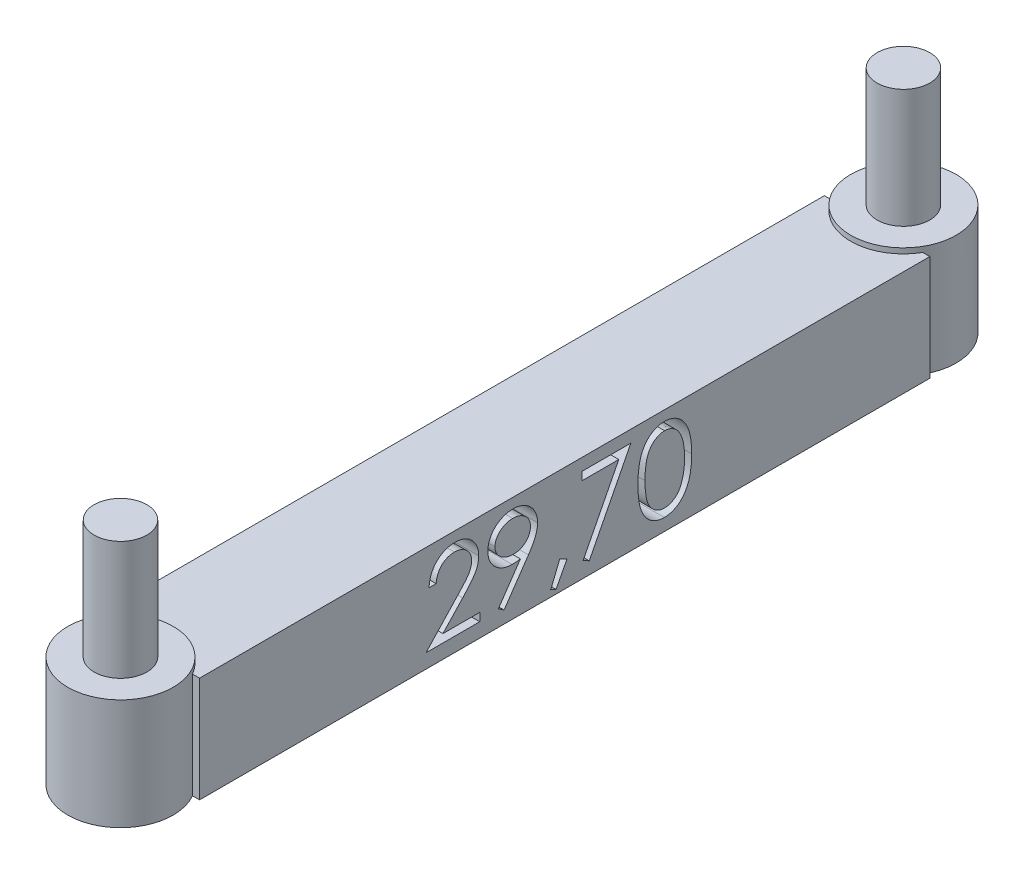
from build123d import *

# Parameters (mm, degrees)
SKIZZE1_W                            = 4
SKIZZE1_H                            = 4
AUFSATZ_LINEAR_AUSTRAGEN1_DEPTH      = 27.7
AUFSATZ_LINEAR_AUSTRAGEN2_DEPTH      = 0.2
AUFSATZ_LINEAR_AUSTRAGEN2_DEPTH_BACK = 4
AUFSATZ_LINEAR_AUSTRAGEN2_START      = 2
SKIZZE2_R                            = 2
SKIZZE3_R                            = 1
AUFSATZ_LINEAR_AUSTRAGEN4_DEPTH      = 4.5
SCHNITT_LINEAR_AUSTRAGEN2_DEPTH      = 1


with BuildPart() as part:
    # Skizze1 → Aufsatz-Linear austragen1 (new body)
    with BuildSketch(Plane.XY):
        Rectangle(SKIZZE1_W, SKIZZE1_H)
    extrude(amount=AUFSATZ_LINEAR_AUSTRAGEN1_DEPTH)

    # Skizze2 → Aufsatz-Linear austragen2 (add, two sides: drawn at the far end of the back side and taken through both)
    with BuildSketch(Plane(origin=(0, 0, 0), x_dir=(1, 0, 0), z_dir=(0, 1, 0)).offset(AUFSATZ_LINEAR_AUSTRAGEN2_START - AUFSATZ_LINEAR_AUSTRAGEN2_DEPTH_BACK)):
        with Locations((0, -28.7)):
            Circle(SKIZZE2_R)
        with Locations((0, 1)):
            Circle(SKIZZE2_R)
    extrude(amount=AUFSATZ_LINEAR_AUSTRAGEN2_DEPTH + AUFSATZ_LINEAR_AUSTRAGEN2_DEPTH_BACK)

    # Skizze3 → Aufsatz-Linear austragen4 (add)
    with BuildSketch(Plane(origin=(0, 2.2, 0), x_dir=(1, 0, 0), z_dir=(0, 1, 0))):
        with Locations((0, -28.7)):
            Circle(SKIZZE3_R)
        with Locations((0, 1)):
            Circle(SKIZZE3_R)
    extrude(amount=AUFSATZ_LINEAR_AUSTRAGEN4_DEPTH)

    # Skizze4 → Schnitt-Linear austragen2 (cut)
    # profile 1 of 5: a face of its own
    with BuildSketch(Plane(origin=(2, 0, 0), x_dir=(0, 0, -1), z_dir=(1, 0, 0))):
        with BuildLine():
            Line((-18.72561599, 0.616837358), (-18.994846759, 0.616837358))
            add(Edge.make_bspline(
                [(-18.994846759, 0.616837358), (-18.993092057, 0.652555261), (-18.989645867, 0.722704274), (-18.973507334, 0.824981908), (-18.950415153, 0.922743164), (-18.917765336, 1.01520309), (-18.877217098, 1.103179211), (-18.82859136, 1.186322081), (-18.770996631, 1.264314529), (-18.705676573, 1.336433537), (-18.634732025, 1.402594312), (-18.558184077, 1.459727378), (-18.477745482, 1.507999667), (-18.393660283, 1.548355018), (-18.3049798, 1.578646314), (-18.212508779, 1.601122005), (-18.115840948, 1.614644587), (-18.049978072, 1.616098118), (-18.016481375, 1.616837358)],
                knots=[0, 0, 0, 0, 1.10065271, 2.161652631, 3.183658789, 4.190468796, 5.17591951, 6.163126047, 7.15150782, 8.156236427, 9.156009102, 10.134482811, 11.092018607, 12.041330605, 13.001268258, 13.972401359, 14.968799086, 16, 16, 16, 16], degree=3))
            add(Edge.make_bspline(
                [(-18.016481375, 1.616837358), (-17.983585883, 1.616067252), (-17.918947416, 1.614554022), (-17.824608546, 1.601558854), (-17.734799437, 1.58120549), (-17.649695637, 1.552649419), (-17.569976153, 1.514262767), (-17.495042115, 1.468150591), (-17.42400142, 1.414819307), (-17.360052748, 1.352030324), (-17.301331537, 1.284999709), (-17.250672461, 1.213438648), (-17.20728975, 1.139527832), (-17.171128881, 1.062703659), (-17.144509334, 0.982242778), (-17.124299441, 0.899316604), (-17.112875944, 0.813066766), (-17.111122724, 0.754689718), (-17.110231375, 0.725010435)],
                knots=[0, 0, 0, 0, 1.111607364, 2.184268762, 3.212621178, 4.221274766, 5.211760367, 6.196651075, 7.1921475, 8.207485113, 9.220403448, 10.201281604, 11.166441695, 12.114753415, 13.065576456, 14.026450734, 14.996634279, 16, 16, 16, 16], degree=3))
            add(Edge.make_bspline(
                [(-17.110231375, 0.725010435), (-17.111682743, 0.683226576), (-17.11456001, 0.600392108), (-17.139172332, 0.478665082), (-17.177612199, 0.360727866), (-17.223895648, 0.265810178), (-17.270586314, 0.189324327), (-17.312661321, 0.126351151), (-17.361916873, 0.058546464), (-17.419069871, -0.013862682), (-17.482938047, -0.091443458), (-17.554099902, -0.174148997), (-17.633062886, -0.2611248), (-17.688484458, -0.320529601), (-17.717202528, -0.351311681)],
                knots=[0, 0, 0, 0, 1.184426356, 2.348067706, 3.509069118, 4.696110526, 5.333549288, 6.050745305, 6.844228056, 7.710549037, 8.667450064, 9.695053472, 10.805634456, 12, 12, 12, 12], degree=3))
            Line((-17.717202528, -0.351311681), (-18.46780349, -1.152393412))
            Line((-18.46780349, -1.152393412), (-17.071769836, -1.152393412))
            Line((-17.071769836, -1.152393412), (-17.071769836, -1.460085719))
            Line((-17.071769836, -1.460085719), (-19.110231375, -1.460085719))
            Line((-19.110231375, -1.460085719), (-17.946769836, -0.218499181))
            add(Edge.make_bspline(
                [(-17.946769836, -0.218499181), (-17.918443076, -0.188929204), (-17.864033167, -0.132131329), (-17.787076673, -0.049208792), (-17.71795754, 0.027719386), (-17.656228346, 0.098507856), (-17.603228199, 0.164192057), (-17.556194857, 0.22264466), (-17.518510065, 0.276434189), (-17.477611154, 0.338783286), (-17.43799917, 0.414908129), (-17.403960008, 0.507937006), (-17.383204423, 0.603703223), (-17.380714564, 0.668419254), (-17.379462144, 0.700971973)],
                knots=[0, 0, 0, 0, 1.329631726, 2.553950428, 3.673215718, 4.687767853, 5.603093632, 6.413772471, 7.123043292, 7.734684054, 8.834405432, 9.900288307, 10.943827018, 12, 12, 12, 12], degree=3))
            add(Edge.make_bspline(
                [(-17.379462144, 0.700971973), (-17.380007066, 0.721441743), (-17.381081002, 0.761783729), (-17.390559029, 0.820931523), (-17.40488232, 0.877987077), (-17.425406827, 0.933125894), (-17.452498318, 0.985793595), (-17.485475501, 1.036054293), (-17.523524127, 1.084644834), (-17.5675395, 1.130204804), (-17.615892232, 1.171931552), (-17.666973017, 1.208895053), (-17.721015964, 1.23978572), (-17.777793211, 1.265108717), (-17.837146471, 1.28497333), (-17.899190538, 1.298737827), (-17.96375398, 1.307379956), (-18.007839834, 1.308549246), (-18.03030349, 1.30914505)],
                knots=[0, 0, 0, 0, 0.991446411, 1.95395049, 2.89581595, 3.838931463, 4.798493298, 5.75982156, 6.748411868, 7.785213223, 8.824556874, 9.840280684, 10.836137867, 11.835679398, 12.848801643, 13.863922112, 14.911575587, 16, 16, 16, 16], degree=3))
            add(Edge.make_bspline(
                [(-18.03030349, 1.30914505), (-18.053764204, 1.308532165), (-18.099837172, 1.307328561), (-18.167482057, 1.298909134), (-18.232012724, 1.284384128), (-18.293591498, 1.264518407), (-18.352322571, 1.239268223), (-18.407920323, 1.207818156), (-18.460259943, 1.170289447), (-18.50943982, 1.127740399), (-18.554751802, 1.08036817), (-18.59456341, 1.02755963), (-18.629349708, 0.970278988), (-18.659700479, 0.908680802), (-18.684348214, 0.842206133), (-18.703182342, 0.771090958), (-18.718085354, 0.695644059), (-18.723064086, 0.643542558), (-18.72561599, 0.616837358)],
                knots=[0, 0, 0, 0, 1.031018746, 2.02475058, 2.990194455, 3.934040569, 4.864654155, 5.795059489, 6.735614925, 7.690564532, 8.649604399, 9.611025574, 10.590972636, 11.591080095, 12.624614302, 13.701020113, 14.821632451, 16, 16, 16, 16], degree=3))
        make_face()
    # profile 2 of 5: a face of its own
    with BuildSketch(Plane(origin=(2, 0, 0), x_dir=(0, 0, -1), z_dir=(1, 0, 0))):
        with BuildLine():
            Line((-16.148692913, -1.537008796), (-16.363837144, -1.387369373))
            Line((-16.363837144, -1.387369373), (-15.529702528, -0.168018412))
            add(Edge.make_bspline(
                [(-15.529702528, -0.168018412), (-15.582923159, -0.174526752), (-15.687717548, -0.187342036), (-15.793263635, -0.189696311), (-15.845207336, -0.19085495)],
                knots=[0, 0, 0, 0, 1.015715272, 2, 2, 2, 2], degree=3))
            add(Edge.make_bspline(
                [(-15.845207336, -0.19085495), (-15.87670052, -0.190048313), (-15.938518886, -0.188464955), (-16.029403159, -0.175914834), (-16.11673364, -0.156586153), (-16.200278802, -0.127744363), (-16.280352663, -0.091900184), (-16.356780418, -0.047451315), (-16.429459181, 0.004839792), (-16.49760839, 0.064696642), (-16.55958988, 0.130420687), (-16.61480985, 0.199982667), (-16.660702248, 0.274190642), (-16.698825036, 0.35153083), (-16.727736853, 0.433114845), (-16.748790457, 0.518014331), (-16.761752475, 0.60682431), (-16.763294557, 0.667274422), (-16.764077528, 0.697967165)],
                knots=[0, 0, 0, 0, 1.060718605, 2.082097864, 3.085795603, 4.069760067, 5.054557537, 6.03741023, 7.043284206, 8.066802108, 9.088538119, 10.083643548, 11.053783639, 12.022749082, 12.983451788, 13.964007469, 14.966251758, 16, 16, 16, 16], degree=3))
            add(Edge.make_bspline(
                [(-16.764077528, 0.697967165), (-16.76259087, 0.739940296), (-16.759672861, 0.822325038), (-16.736188418, 0.94269684), (-16.69756527, 1.056513877), (-16.643712376, 1.1634769), (-16.575882614, 1.262047248), (-16.494360966, 1.350854628), (-16.399643282, 1.428635931), (-16.293887266, 1.495496569), (-16.179584676, 1.549269423), (-16.059868684, 1.58890311), (-15.935656581, 1.612216322), (-15.851512864, 1.615289917), (-15.809149644, 1.616837358)],
                knots=[0, 0, 0, 0, 1.022988612, 2.007919123, 2.978103895, 3.94594894, 4.918897164, 5.887013414, 6.875921846, 7.89917871, 8.930658928, 9.948724884, 10.967259574, 12, 12, 12, 12], degree=3))
            add(Edge.make_bspline(
                [(-15.809149644, 1.616837358), (-15.767588141, 1.615268647), (-15.68546653, 1.612169021), (-15.564704524, 1.589468476), (-15.449040795, 1.551208471), (-15.339116521, 1.498335988), (-15.237339882, 1.432060924), (-15.145817758, 1.353088475), (-15.066638725, 1.261369452), (-14.999932541, 1.159122174), (-14.946386792, 1.049264762), (-14.907753407, 0.934592828), (-14.883971431, 0.815931067), (-14.880974579, 0.735535804), (-14.879462144, 0.694962358)],
                knots=[0, 0, 0, 0, 1.026385292, 2.028040595, 3.023318987, 4.028184125, 5.03290303, 6.015178782, 7.004435299, 8.016004309, 9.023023918, 10.015172535, 10.998308025, 12, 12, 12, 12], degree=3))
            add(Edge.make_bspline(
                [(-14.879462144, 0.694962358), (-14.880472209, 0.6634677), (-14.882520872, 0.599588665), (-14.896866278, 0.502534086), (-14.921226437, 0.403575889), (-14.94887075, 0.319814521), (-14.975555466, 0.25063585), (-15.000670721, 0.195991639), (-15.028538281, 0.13847627), (-15.06104008, 0.078692838), (-15.095979192, 0.015879236), (-15.135458572, -0.04933452), (-15.178577633, -0.117035943), (-15.209288822, -0.162676304), (-15.225015028, -0.186047258)],
                knots=[0, 0, 0, 0, 1.179839688, 2.393009684, 3.667231171, 4.993948276, 5.694988576, 6.444077775, 7.246288328, 8.089075292, 8.993003841, 9.939041771, 10.944649915, 12, 12, 12, 12], degree=3))
            Line((-15.225015028, -0.186047258), (-16.148692913, -1.537008796))
        make_face()
        with BuildLine():
            add(Edge.make_bspline(
                [(-15.795327528, 0.116837358), (-15.771469802, 0.117489115), (-15.725026919, 0.118757866), (-15.656989235, 0.126480073), (-15.592768489, 0.140172061), (-15.532193132, 0.159817528), (-15.474655788, 0.183523245), (-15.421070364, 0.213704947), (-15.371392013, 0.249719205), (-15.325288076, 0.290184933), (-15.284347505, 0.335142576), (-15.24788205, 0.382197239), (-15.216887278, 0.431555476), (-15.192404469, 0.483835415), (-15.172274833, 0.537764451), (-15.15837368, 0.594211041), (-15.150672822, 0.652881099), (-15.149360044, 0.692737092), (-15.148692913, 0.712991204)],
                knots=[0, 0, 0, 0, 1.163407946, 2.26475976, 3.333800367, 4.359385343, 5.366239384, 6.363380779, 7.350133999, 8.353570782, 9.349036268, 10.310270964, 11.253520213, 12.184142, 13.120487599, 14.056272588, 15.012232024, 16, 16, 16, 16], degree=3))
            add(Edge.make_bspline(
                [(-15.148692913, 0.712991204), (-15.149266915, 0.733253774), (-15.150398057, 0.773183654), (-15.159472885, 0.831940574), (-15.175437362, 0.888249083), (-15.196857778, 0.942417452), (-15.225075124, 0.994000628), (-15.258935255, 1.043646232), (-15.299163069, 1.091039484), (-15.345450983, 1.135065756), (-15.395366314, 1.17564967), (-15.448561029, 1.211466306), (-15.504596671, 1.241484475), (-15.563131376, 1.26625502), (-15.624287104, 1.285585114), (-15.688027665, 1.299485712), (-15.754675156, 1.307175787), (-15.799916258, 1.308480268), (-15.822971759, 1.30914505)],
                knots=[0, 0, 0, 0, 0.972161553, 1.915763587, 2.844109794, 3.775983486, 4.705125789, 5.659731448, 6.655561913, 7.682237399, 8.721216875, 9.739758359, 10.754845918, 11.767244016, 12.7857855, 13.828538656, 14.893392813, 16, 16, 16, 16], degree=3))
            add(Edge.make_bspline(
                [(-15.822971759, 1.30914505), (-15.845826748, 1.308479194), (-15.890668047, 1.307172791), (-15.956723041, 1.299500329), (-16.020032613, 1.285491628), (-16.081011145, 1.266263974), (-16.139544111, 1.241482627), (-16.195577111, 1.211464733), (-16.248784268, 1.175657914), (-16.298651743, 1.135033824), (-16.34502139, 1.091244413), (-16.384557558, 1.043438616), (-16.41849518, 0.994026453), (-16.446673754, 0.942410588), (-16.468104483, 0.888250915), (-16.484066199, 0.831940078), (-16.493141769, 0.773183783), (-16.494272809, 0.733253818), (-16.494846759, 0.712991204)],
                knots=[0, 0, 0, 0, 1.099389452, 2.15699305, 3.192601482, 4.213358962, 5.227959689, 6.245255729, 7.266013209, 8.307253147, 9.336162325, 10.327954924, 11.284637477, 12.215801273, 13.149702402, 14.080068371, 15.025723358, 16, 16, 16, 16], degree=3))
            add(Edge.make_bspline(
                [(-16.494846759, 0.712991204), (-16.494327394, 0.692721319), (-16.493303111, 0.652745397), (-16.483422148, 0.594008489), (-16.466897908, 0.537704322), (-16.444767002, 0.483285431), (-16.415622782, 0.431280981), (-16.379859484, 0.381937528), (-16.337940444, 0.334695713), (-16.290426026, 0.290289532), (-16.238424745, 0.249530524), (-16.182884677, 0.213933054), (-16.12476196, 0.183870959), (-16.063851991, 0.159749772), (-16.000606162, 0.140368347), (-15.93445605, 0.126505308), (-15.865620417, 0.118831936), (-15.81898329, 0.117508596), (-15.795327528, 0.116837358)],
                knots=[0, 0, 0, 0, 0.952633368, 1.87876736, 2.791047057, 3.707742249, 4.635551637, 5.587206343, 6.568248508, 7.601284464, 8.641511608, 9.671105535, 10.699146789, 11.713763218, 12.747829548, 13.806491675, 14.887386225, 16, 16, 16, 16], degree=3))
        make_face(mode=Mode.SUBTRACT)
    # profile 3 of 5: a face of its own
    with BuildSketch(Plane(origin=(2, 0, 0), x_dir=(0, 0, -1), z_dir=(1, 0, 0))):
        Polygon((-14.039317913, -0.921624181), (-13.764077528, -1.055037642), (-14.177539067, -1.844701104), (-14.379462144, -1.756960719), align=None)
    # profile 4 of 5: a face of its own
    with BuildSketch(Plane(origin=(2, 0, 0), x_dir=(0, 0, -1), z_dir=(1, 0, 0))):
        Polygon((-13.187154452, 1.539914281), (-11.341000605, 1.539914281), (-12.917923682, -1.537008796), (-13.150495798, -1.409003988), (-11.796529452, 1.232221973), (-13.187154452, 1.232221973), align=None)
    # profile 5 of 5: a face of its own
    with BuildSketch(Plane(origin=(2, 0, 0), x_dir=(0, 0, -1), z_dir=(1, 0, 0))):
        with BuildLine():
            add(Edge.make_bspline(
                [(-11.071769836, 0.038712358), (-11.071488678, 0.086795833), (-11.070942523, 0.180198677), (-11.064866734, 0.316299798), (-11.054773584, 0.443980046), (-11.04094155, 0.563245531), (-11.024108995, 0.674127044), (-11.001638578, 0.776328264), (-10.976084747, 0.870322213), (-10.946468365, 0.956415397), (-10.91305026, 1.035767714), (-10.876678037, 1.109846458), (-10.835908213, 1.178539543), (-10.793070859, 1.242943363), (-10.746431941, 1.302003673), (-10.697318692, 1.356554526), (-10.643814226, 1.40533517), (-10.587737362, 1.449774857), (-10.528580392, 1.488731547), (-10.468029536, 1.523045323), (-10.405668016, 1.552359495), (-10.341325574, 1.57540844), (-10.275580524, 1.594446309), (-10.208203039, 1.607465407), (-10.13908187, 1.615657043), (-10.092426354, 1.616440187), (-10.068765028, 1.616837358)],
                knots=[0, 0, 0, 0, 1.646270934, 3.197905019, 4.663502075, 6.030701355, 7.308322542, 8.50163776, 9.611534131, 10.641858119, 11.616356847, 12.558055219, 13.465016945, 14.349605745, 15.204443733, 16.039544428, 16.859896111, 17.680448484, 18.487036065, 19.28249412, 20.06191084, 20.843045899, 21.620316918, 22.403196591, 23.190181807, 24, 24, 24, 24], degree=3))
            add(Edge.make_bspline(
                [(-10.068765028, 1.616837358), (-10.044906047, 1.61641923), (-9.997458039, 1.615587707), (-9.927309146, 1.607595756), (-9.858780848, 1.594334793), (-9.7921653, 1.575545387), (-9.726915312, 1.552234807), (-9.663541248, 1.523017278), (-9.601649464, 1.48900682), (-9.542223503, 1.449043497), (-9.484610976, 1.40448726), (-9.430227007, 1.354119258), (-9.379066648, 1.29844807), (-9.330487815, 1.23806933), (-9.285868731, 1.171824971), (-9.243377218, 1.100867163), (-9.205344045, 1.023954993), (-9.168714323, 0.942371735), (-9.137096906, 0.853860027), (-9.108582981, 0.758918804), (-9.085543865, 0.656426644), (-9.06635306, 0.546921291), (-9.051486007, 0.430000591), (-9.040658028, 0.305915177), (-9.034938241, 0.174583414), (-9.033861068, 0.084790972), (-9.033308298, 0.038712358)],
                knots=[0, 0, 0, 0, 0.810914788, 1.612654377, 2.396697861, 3.181598691, 3.963628158, 4.749916497, 5.551656086, 6.361998678, 7.18212741, 8.025565596, 8.878627764, 9.750805457, 10.657531673, 11.591944965, 12.560506719, 13.57287815, 14.630710178, 15.753379473, 16.941251878, 18.199788006, 19.531962791, 20.947069417, 22.433333509, 24, 24, 24, 24], degree=3))
            add(Edge.make_bspline(
                [(-9.033308298, 0.038712358), (-9.033866799, -0.007165278), (-9.034955015, -0.096555979), (-9.040593907, -0.227296815), (-9.051701305, -0.35072371), (-9.065595581, -0.467132677), (-9.084839263, -0.576039208), (-9.108500834, -0.677820164), (-9.134772539, -0.772915082), (-9.167202363, -0.860544921), (-9.202697258, -0.941932112), (-9.241315997, -1.017932525), (-9.282690134, -1.089217918), (-9.327766201, -1.155217701), (-9.375811984, -1.216399407), (-9.427855803, -1.271683084), (-9.48243059, -1.322400803), (-9.540212661, -1.367530769), (-9.600565419, -1.40703203), (-9.662244628, -1.442358188), (-9.72634467, -1.470843355), (-9.791412916, -1.495301962), (-9.858380087, -1.513988063), (-9.927162707, -1.526908511), (-9.997410909, -1.535970095), (-10.044897965, -1.536661364), (-10.068765028, -1.537008796)],
                knots=[0, 0, 0, 0, 1.561518951, 3.042555995, 4.452378317, 5.7783523, 7.031515105, 8.214008947, 9.334062868, 10.386615937, 11.391082383, 12.354592575, 13.286541444, 14.194233754, 15.072674879, 15.931287219, 16.775624067, 17.606195743, 18.42308326, 19.229000347, 20.022332153, 20.807536673, 21.593273796, 22.3848459, 23.188221202, 24, 24, 24, 24], degree=3))
            add(Edge.make_bspline(
                [(-10.068765028, -1.537008796), (-10.092425698, -1.536609063), (-10.139079919, -1.535820867), (-10.208210569, -1.52766624), (-10.275309806, -1.514555809), (-10.340708738, -1.496198719), (-10.404742894, -1.47372886), (-10.466539711, -1.444454274), (-10.526786297, -1.410739358), (-10.585321917, -1.372343282), (-10.641046626, -1.328353268), (-10.694274002, -1.279698163), (-10.743666876, -1.225163811), (-10.789638958, -1.165611305), (-10.833331033, -1.101588526), (-10.873521925, -1.032221349), (-10.910696943, -0.957784826), (-10.944677077, -0.877798045), (-10.974804503, -0.791093821), (-11.001416825, -0.69668024), (-11.022428959, -0.59372398), (-11.04041435, -0.483051951), (-11.054920964, -0.364188583), (-11.064824671, -0.237069344), (-11.070945798, -0.101773451), (-11.071490144, -0.008970787), (-11.071769836, 0.038712358)],
                knots=[0, 0, 0, 0, 0.810891512, 1.598919785, 2.382837074, 3.152667961, 3.926044502, 4.706494248, 5.493654104, 6.291793342, 7.103789334, 7.925228297, 8.761435821, 9.622817696, 10.50288917, 11.416980706, 12.369136599, 13.353924996, 14.394355917, 15.514179734, 16.714354668, 17.994756427, 19.357759367, 20.818452758, 22.365282078, 24, 24, 24, 24], degree=3))
        make_face()
        with BuildLine():
            add(Edge.make_bspline(
                [(-10.802539067, 0.039914281), (-10.802436684, -0.000156032), (-10.802237978, -0.077924642), (-10.797046949, -0.190933152), (-10.789975322, -0.296336291), (-10.78085421, -0.394267893), (-10.767308825, -0.484396476), (-10.752131579, -0.567341918), (-10.733661787, -0.642665264), (-10.711808915, -0.710883388), (-10.68691826, -0.773154018), (-10.659741806, -0.831097917), (-10.630546901, -0.885399576), (-10.597873343, -0.935571241), (-10.562289003, -0.981776524), (-10.524597638, -1.024833238), (-10.483392566, -1.06323065), (-10.426389358, -1.10928224), (-10.351135237, -1.156870069), (-10.256317704, -1.198309575), (-10.158887603, -1.22435168), (-10.09275796, -1.227663471), (-10.059750605, -1.229316488)],
                knots=[0, 0, 0, 0, 1.459021318, 2.831673884, 4.118529203, 5.306027144, 6.411944654, 7.436330062, 8.375795394, 9.233974572, 10.042671642, 10.816086306, 11.563610507, 12.285937304, 12.993564865, 13.685989202, 14.367179055, 15.041617293, 16.353048772, 17.594441528, 18.799311195, 20, 20, 20, 20], degree=3))
            add(Edge.make_bspline(
                [(-10.059750605, -1.229316488), (-10.026529744, -1.227946962), (-9.96015661, -1.225210737), (-9.863184785, -1.198811819), (-9.769044554, -1.158980785), (-9.695268605, -1.111882923), (-9.639140711, -1.06703007), (-9.598926148, -1.028788942), (-9.56201582, -0.985969628), (-9.527008328, -0.939770231), (-9.494900549, -0.889308102), (-9.465703573, -0.834825894), (-9.439060704, -0.776172313), (-9.423881522, -0.735226823), (-9.416120798, -0.71429245)],
                knots=[0, 0, 0, 0, 1.353760809, 2.704726607, 4.075137775, 5.516104923, 6.260822281, 7.007110065, 7.778089737, 8.566572457, 9.372053459, 10.217411131, 11.088608312, 12, 12, 12, 12], degree=3))
            add(Edge.make_bspline(
                [(-9.416120798, -0.71429245), (-9.407076425, -0.687524102), (-9.388712471, -0.633172875), (-9.365045235, -0.548861174), (-9.346406322, -0.460401662), (-9.329637723, -0.36832299), (-9.318192246, -0.271946104), (-9.308979835, -0.171569203), (-9.303553532, -0.067116607), (-9.302880888, 0.003850528), (-9.302539067, 0.039914281)],
                knots=[0, 0, 0, 0, 0.884706709, 1.796334032, 2.740027952, 3.714592787, 4.726048262, 5.777819803, 6.87074269, 8, 8, 8, 8], degree=3))
            add(Edge.make_bspline(
                [(-9.302539067, 0.039914281), (-9.303010658, 0.0759722), (-9.30393319, 0.146509198), (-9.307459465, 0.249810496), (-9.316565386, 0.34792572), (-9.326678917, 0.441277554), (-9.34159082, 0.529349242), (-9.357668941, 0.612878075), (-9.37926998, 0.690829239), (-9.402344073, 0.764423166), (-9.428752983, 0.832823727), (-9.457823612, 0.89634983), (-9.488870834, 0.955308165), (-9.522592755, 1.009536972), (-9.558589054, 1.059279152), (-9.597809811, 1.103537376), (-9.638699273, 1.143683348), (-9.695971147, 1.189508408), (-9.770949109, 1.236232718), (-9.864245379, 1.279231941), (-9.961334502, 1.303924763), (-10.026968892, 1.307406209), (-10.059750605, 1.30914505)],
                knots=[0, 0, 0, 0, 1.31362396, 2.569729283, 3.763502607, 4.902122613, 5.988968491, 7.01645872, 7.998833611, 8.933434873, 9.825090667, 10.667526885, 11.477055099, 12.250526234, 12.991942729, 13.710640831, 14.402115721, 15.076753259, 16.378508321, 17.609869233, 18.806226677, 20, 20, 20, 20], degree=3))
            add(Edge.make_bspline(
                [(-10.059750605, 1.30914505), (-10.092931113, 1.30740381), (-10.159352575, 1.303918158), (-10.257450822, 1.279323941), (-10.351483123, 1.236455684), (-10.426262816, 1.189353651), (-10.483574633, 1.144492241), (-10.523931227, 1.105589566), (-10.561770803, 1.063035633), (-10.596628832, 1.016405421), (-10.629276789, 0.966292249), (-10.659260514, 0.912301879), (-10.686275368, 0.85416071), (-10.71120497, 0.791918051), (-10.733124503, 0.723705813), (-10.751205043, 0.648475247), (-10.767908231, 0.565793625), (-10.779732748, 0.475176904), (-10.790244538, 0.377220773), (-10.796999979, 0.2715545), (-10.802255343, 0.15835646), (-10.802442598, 0.080185752), (-10.802539067, 0.039914281)],
                knots=[0, 0, 0, 0, 1.207732386, 2.417664972, 3.655092373, 4.956220595, 5.625982001, 6.301752483, 6.994047911, 7.697131622, 8.419323945, 9.170223765, 9.943494443, 10.752040957, 11.610060368, 12.549350801, 13.567764191, 14.679664412, 15.874934091, 17.154273443, 18.533957287, 20, 20, 20, 20], degree=3))
        make_face(mode=Mode.SUBTRACT)
    extrude(amount=-SCHNITT_LINEAR_AUSTRAGEN2_DEPTH, mode=Mode.SUBTRACT)


solid = part.part
